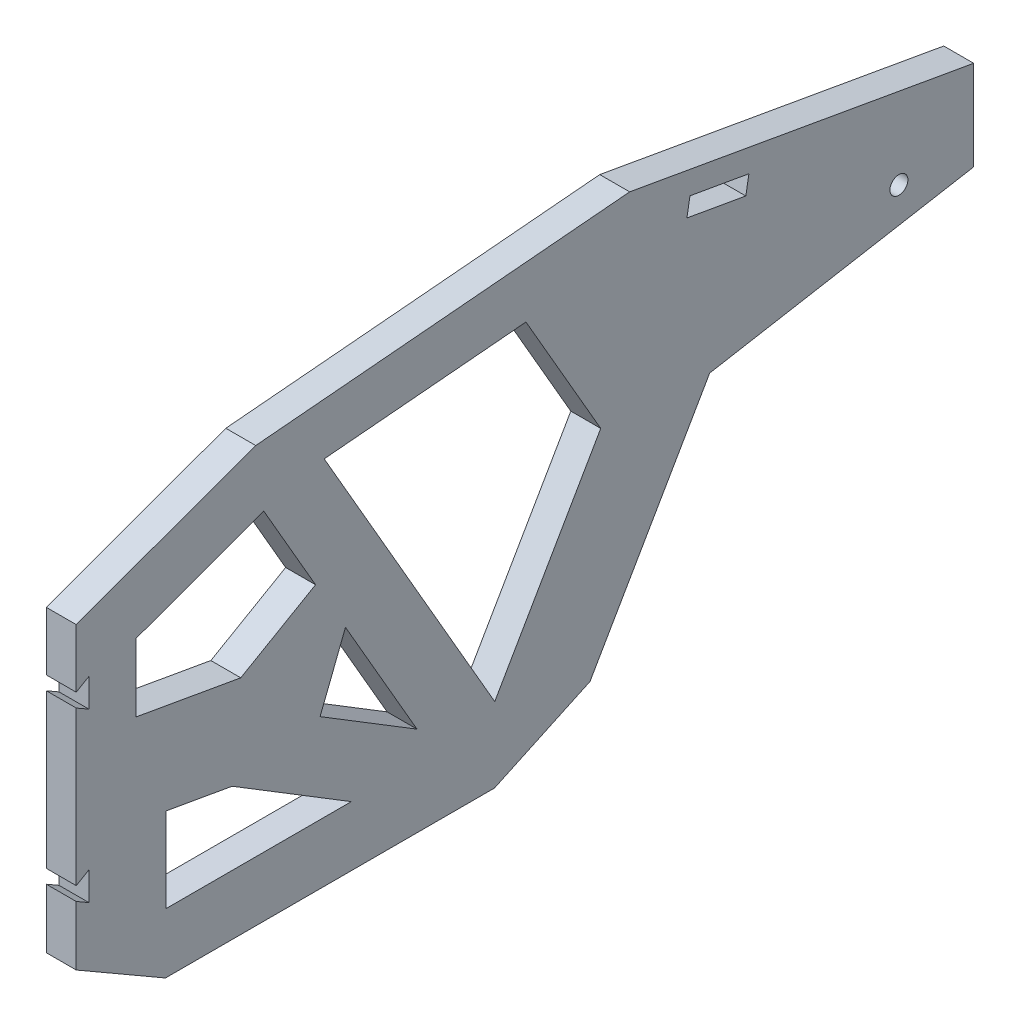
from build123d import *

# Parameters (mm, degrees)
ESQUISSE1_W                  = 300
ESQUISSE1_H                  = 150
BOSS_EXTRU_1_DEPTH           = 5
ESQUISSE2_OUTSIDE_W          = 369.112
ESQUISSE2_OUTSIDE_H          = 219.112
ENL_V_MAT_EXTRU_1_DEPTH      = 5
ENL_V_MAT_EXTRU_2_DEPTH      = 336.559234711
ENL_V_MAT_EXTRU_2_DEPTH_BACK = 336.559234711
ENL_V_MAT_EXTRU_4_DEPTH      = 336.559234711
ENL_V_MAT_EXTRU_4_DEPTH_BACK = 336.559234711
ESQUISSE5_R                  = 3
ENL_V_MAT_EXTRU_5_DEPTH      = 49
EMPREINTE1_START             = -5
EMPREINTE1_DEPTH             = 10
D_PLACER_START               = -5
D_PLACER_LA_FACE1_DEPTH      = 10


# Read off the part's stored shape, not the designer's step: Empreinte1, Déplacer la face1
with BuildPart() as part:
    # Esquisse1 → Boss.-Extru.1 (new, symmetric)
    with BuildSketch(Plane(origin=(0, 0, 0), x_dir=(0, 0, -1), z_dir=(1, 0, 0))):
        with Locations((150, 75)):
            Rectangle(ESQUISSE1_W, ESQUISSE1_H)
    extrude(amount=BOSS_EXTRU_1_DEPTH, both=True)

    # Esquisse2 outside → Enlèv. mat.-Extru.1 (cut, symmetric)
    with BuildSketch(Plane(origin=(0, 0, 0), x_dir=(0, 0, -1), z_dir=(1, 0, 0))):
        with Locations((150, 75)):
            Rectangle(ESQUISSE2_OUTSIDE_W, ESQUISSE2_OUTSIDE_H)
        Polygon((0, 117.225703003), (60, 139.063917059), (185, 150), (300, 129.722397219), (300, 99.722397219), (211.741963761, 84.160124165), (171.741963761, 14.878091862), (139.835792798, 0), (29.835792798, 0), (0, 17.225703003), align=None, mode=Mode.SUBTRACT)
    extrude(amount=ENL_V_MAT_EXTRU_1_DEPTH, both=True, mode=Mode.SUBTRACT)

    # Esquisse3 → Enlèv. mat.-Extru.2 (cut, two sides: drawn at the far end of the back side and taken through both)
    with BuildSketch(Plane(origin=(5, 0, 0), x_dir=(0, 0, -1), z_dir=(1, 0, 0)).offset(-ENL_V_MAT_EXTRU_2_DEPTH_BACK)):
        Polygon((20, 103.221552239), (20, 80.493304508), (55, 74.321860183), (80, 88.755616913), (62.679491924, 118.755616913), align=None)
        Polygon((90, 71.435108837), (113.922571241, 30), (81.508057782, 49.831775443), align=None)
        Polygon((82.886751346, 123.755616913), (139.903333355, 25), (175.32640016, 86.354551467), (150.32640016, 129.655821657), align=None)
        Polygon((91.944969354, 20), (30, 20), (30, 48.267236345), (52.117107943, 44.367393479), align=None)
    extrude(amount=ENL_V_MAT_EXTRU_2_DEPTH + ENL_V_MAT_EXTRU_2_DEPTH_BACK, mode=Mode.SUBTRACT)

    # Esquisse5 → Enlèv. mat.-Extru.4 (cut, two sides: drawn at the far end of the back side and taken through both)
    with BuildSketch(Plane.ZY.offset(5).offset(-ENL_V_MAT_EXTRU_4_DEPTH_BACK)):
        with Locations((-275, 107.010571736)):
            Circle(ESQUISSE5_R)
    extrude(amount=ENL_V_MAT_EXTRU_4_DEPTH + ENL_V_MAT_EXTRU_4_DEPTH_BACK, mode=Mode.SUBTRACT)

    # Esquisse6 → Enlèv. mat.-Extru.5 (cut)
    with BuildSketch(Plane(origin=(5, 0, 0), x_dir=(0, 0, -1), z_dir=(1, 0, 0))):
        Polygon((205.171612033, 138.776729635), (224.867767093, 135.303766081), (223.825878027, 129.394919563), (204.129722967, 132.867883116), align=None)
    extrude(amount=-ENL_V_MAT_EXTRU_5_DEPTH, mode=Mode.SUBTRACT)

    # Empreinte1 outline → Empreinte1 (cut)
    with BuildSketch(Plane.YZ.offset(EMPREINTE1_START)):
        Polygon((97.361325712, 0), (93.361325712, 0), (91.051924635, -4), (99.670726788, -4), align=None)
        Polygon((35.051924635, -4), (43.670726788, -4), (41.361325712, 0), (37.361325712, 0), align=None)
    extrude(amount=EMPREINTE1_DEPTH, mode=Mode.SUBTRACT)

    # Déplacer la face1 outline → Déplacer la face1 (cut)
    with BuildSketch(Plane.YZ.offset(D_PLACER_START)):
        Polygon((93.361325712, 0), (93.072650577, 0), (90.618911933, -4.25), (100.10373949, -4.25), (97.650000846, 0), (97.361325712, 0), (99.670726788, -4), (91.051924635, -4), align=None)
        Polygon((34.618911933, -4.25), (44.10373949, -4.25), (41.650000846, 0), (41.361325712, 0), (43.670726788, -4), (35.051924635, -4), (37.361325712, 0), (37.072650577, 0), align=None)
    extrude(amount=D_PLACER_LA_FACE1_DEPTH, mode=Mode.SUBTRACT)


solid = part.part
